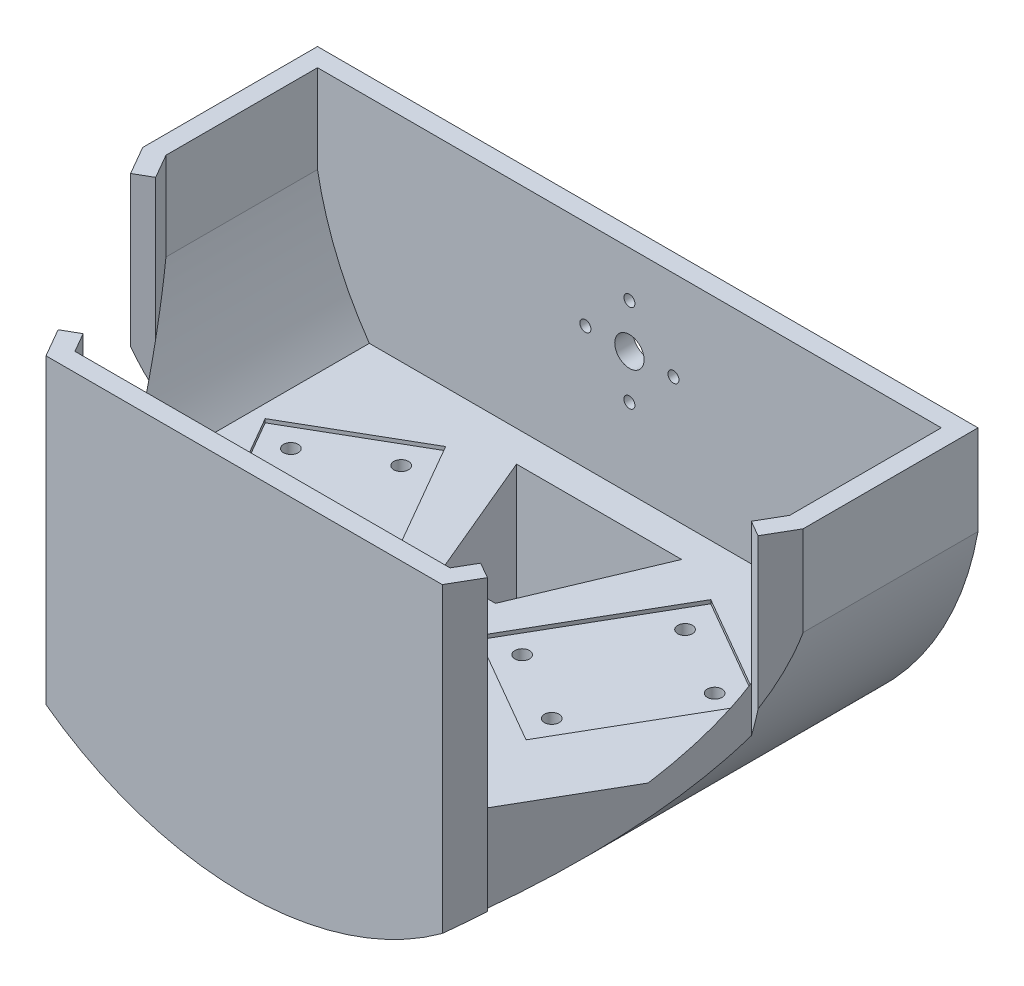
from build123d import *

# Parameters (mm, degrees)
BOSS_EXTRUDE1_DEPTH      = 50
BOSS_EXTRUDE1_DEPTH_BACK = 50
CUT_EXTRUDE1_DEPTH       = 151.665191733
SHELL1_T                 = -5
CUT_EXTRUDE2_START       = -5
CUT_EXTRUDE2_OUTLINE_W   = 54
CUT_EXTRUDE2_OUTLINE_H   = 87
CUT_EXTRUDE2_DEPTH       = 5
BOSS_EXTRUDE3_REACH      = 149.054
SKETCH6_R                = 2
CUT_EXTRUDE4_DEPTH       = 121.370262108
SKETCH6_4_R              = 2
CUT_EXTRUDE5_DEPTH       = 1
CUT_EXTRUDE6_DEPTH       = 31
SKETCH11_R               = 4
SKETCH11_R_2             = 1.5
CUT_EXTRUDE7_DEPTH       = 31
SKETCH12_R               = 4.5
CUT_EXTRUDE8_DEPTH       = 28
CUT_EXTRUDE10_REACH      = 122.37
CUT_EXTRUDE10_END_RADIUS = 86.3884
SKETCH14_W               = 15
SKETCH14_H               = 35.732848509
SKETCH14_W_2             = 30
SKETCH14_H_2             = 22.886792525


# Read off the part's stored shape, not the designer's step: Cut-Extrude2
with BuildPart() as part:
    # Sketch2 → Boss-Extrude1 (new, two sides: drawn at the far end of the back side and taken through both)
    with BuildSketch(Plane(origin=(0, 0, 0), x_dir=(1, 0, 0), z_dir=(0, 1, 0)).offset(-BOSS_EXTRUDE1_DEPTH_BACK)):
        Polygon((-90, 7.353829072), (-54, -55), (54, -55), (90, 7.353829072), (90, 55), (-90, 55), align=None)
    extrude(amount=BOSS_EXTRUDE1_DEPTH + BOSS_EXTRUDE1_DEPTH_BACK)

    # Sketch3 → Cut-Extrude1 (cut, through all)
    with BuildSketch(Plane(origin=(0, 0, -55), x_dir=(-1, 0, 0), z_dir=(0, 0, -1))):
        with BuildLine():
            ThreePointArc((4.5e-08, -50), (-58.743320462, -28.619184987), (-90, 25.518943344))
            Line((-90, 25.518943344), (-90, -50))
            Line((-90, -50), (4.5e-08, -50))
        make_face()
        with BuildLine():
            ThreePointArc((90, 25.518943344), (58.743320497, -28.619184957), (4.5e-08, -50))
            Line((4.5e-08, -50), (90, -50))
            Line((90, -50), (90, 25.518943344))
        make_face()
    extrude(amount=-CUT_EXTRUDE1_DEPTH, mode=Mode.SUBTRACT)

    # Shell1
    shell1_openings = [part.faces().sort_by_distance(p)[0] for p in [
        (0, 50, -4.375017638),
    ]]
    offset(amount=SHELL1_T, openings=shell1_openings, kind=Kind.INTERSECTION)

    # Cut-Extrude2 outline → Cut-Extrude2 (cut)
    with BuildSketch(Plane(origin=(-64.315698604, 0, 37.132685902), x_dir=(0.500000000000001, 0, 0.8660254037844382), z_dir=(-0.866025403784438, 0, 0.5000000000000009)).offset(CUT_EXTRUDE2_START)):
        with Locations((-15.368602792, 6.5)):
            Rectangle(CUT_EXTRUDE2_OUTLINE_W, CUT_EXTRUDE2_OUTLINE_H)
    cut_extrude2 = extrude(amount=CUT_EXTRUDE2_DEPTH, mode=Mode.SUBTRACT)

    # Mirror1: Cut-Extrude2 across plane
    add(cut_extrude2.mirror(Plane(origin=(0, 0, 0), x_dir=(0, 0, 1), z_dir=(1, 0, 0))), mode=Mode.SUBTRACT)

    # Boss-Extrude3: up to this face of the body (flat: up to its plane)
    boss_extrude3_end = Plane(part.part.faces().sort_by_distance((0, 5.038192354, 50))[0])
    # Sketch8 → Boss-Extrude3 (add, up to the picked face)
    with BuildSketch(Plane.XY.offset(-50), mode=Mode.PRIVATE) as boss_extrude3_sk1:
        with BuildLine():
            Line((76.893599213, -8), (-76.893599213, -8))
            ThreePointArc((-76.893599213, -8), (0, -50), (76.893599213, -8))
        make_face()
    boss_extrude3_tool1 = split(extrude(boss_extrude3_sk1.sketch, amount=BOSS_EXTRUDE3_REACH, mode=Mode.PRIVATE), bisect_by=boss_extrude3_end, keep=Keep.BOTH, mode=Mode.PRIVATE)
    add(boss_extrude3_tool1.solids().sort_by(Axis((0, -25.182235, -50), (0, 0, 1)))[0])

    # Sketch6 → Cut-Extrude4 (cut, through all)
    with BuildSketch(Plane(origin=(0, -8, 0), x_dir=(1, 0, 0), z_dir=(0, 1, 0))):
        with Locations(Location((-57.742314098, 15.481878155, 0), (0, 0, 270))):
            Circle(SKETCH6_R)
        with Locations(Location((-38.689755215, 26.481878155, 0), (0, 0, 270))):
            Circle(SKETCH6_R)
        with Locations(Location((-41.492314098, -12.663947468, 0), (0, 0, 270))):
            Circle(SKETCH6_R)
        with Locations(Location((-22.439755215, -1.663947468, 0), (0, 0, 270))):
            Circle(SKETCH6_R)
        with Locations(Location((22.439755215, -1.663947468, 0), (0, 0, 270))):
            Circle(SKETCH6_R)
        with Locations(Location((41.492314098, -12.663947468, 0), (0, 0, 270))):
            Circle(SKETCH6_R)
        with Locations(Location((38.689755215, 26.481878155, 0), (0, 0, 270))):
            Circle(SKETCH6_R)
        with Locations(Location((57.742314098, 15.481878155, 0), (0, 0, 270))):
            Circle(SKETCH6_R)
    extrude(amount=-CUT_EXTRUDE4_DEPTH, mode=Mode.SUBTRACT)

    # Sketch6<4> → Cut-Extrude5 (cut)
    # profile 1 of 2: a face of its own
    with BuildSketch(Plane(origin=(0, -8, 0), x_dir=(1, 0, 0), z_dir=(0, 1, 0))):
        Polygon((36.127577388, 36.044055982), (67.304491924, 18.044055982), (44.054491924, -22.226125294), (12.877577388, -4.226125294), align=None)
        with Locations(Location((38.689755215, 26.481878155, 0), (0, 0, 270))):
            Circle(SKETCH6_4_R, mode=Mode.SUBTRACT)
        with Locations(Location((22.439755215, -1.663947468, 0), (0, 0, 270))):
            Circle(SKETCH6_4_R, mode=Mode.SUBTRACT)
        with Locations(Location((41.492314098, -12.663947468, 0), (0, 0, 270))):
            Circle(SKETCH6_4_R, mode=Mode.SUBTRACT)
        with Locations(Location((57.742314098, 15.481878155, 0), (0, 0, 270))):
            Circle(SKETCH6_4_R, mode=Mode.SUBTRACT)
    # profile 2 of 2: a face of its own
    with BuildSketch(Plane(origin=(0, -8, 0), x_dir=(1, 0, 0), z_dir=(0, 1, 0))):
        Polygon((-36.127577388, 36.044055982), (-12.877577388, -4.226125294), (-44.054491924, -22.226125294), (-67.304491924, 18.044055982), align=None)
    extrude(amount=-CUT_EXTRUDE5_DEPTH, mode=Mode.SUBTRACT)

    # Sketch10 → Cut-Extrude6 (cut)
    with BuildSketch(Plane(origin=(0, -8, 0), x_dir=(1, 0, 0), z_dir=(0, 1, 0))):
        Polygon((-76.893599213, -5.347122994), (-54.169872981, -44.705771366), (-58.5, -47.205771366), (-56.886751346, -50), (-76.893599213, -50), align=None)
    cut_extrude6 = extrude(amount=-CUT_EXTRUDE6_DEPTH, mode=Mode.SUBTRACT)

    # Mirror2: Cut-Extrude6 across plane
    add(cut_extrude6.mirror(Plane(origin=(0, 0, 0), x_dir=(0, 0, 1), z_dir=(1, 0, 0))), mode=Mode.SUBTRACT)

    # Sketch11 → Cut-Extrude7 (cut)
    with BuildSketch(Plane(origin=(0, 0, -55), x_dir=(-1, 0, 0), z_dir=(0, 0, -1))):
        with Locations((0, 25.54)):
            Circle(SKETCH11_R)
        with Locations((-12, 25.54)):
            Circle(SKETCH11_R_2)
        with Locations((0, 37.54)):
            Circle(SKETCH11_R_2)
        with Locations((12, 25.54)):
            Circle(SKETCH11_R_2)
        with Locations((0, 13.54)):
            Circle(SKETCH11_R_2)
    extrude(amount=-CUT_EXTRUDE7_DEPTH, mode=Mode.SUBTRACT)

    # Sketch12 → Cut-Extrude8 (cut)
    with BuildSketch(Plane(origin=(0, -50, 0), x_dir=(1, 0, 0), z_dir=(0, 1, 0))):
        with Locations(Location((-41.492314098, -12.663947468, 0), (0, 0, 90))):
            Circle(SKETCH12_R)
        with Locations(Location((-57.742314098, 15.481878155, 0), (0, 0, 90))):
            Circle(SKETCH12_R)
        with Locations(Location((-38.689755215, 26.481878155, 0), (0, 0, 90))):
            Circle(SKETCH12_R)
        with Locations(Location((57.742314098, 15.481878155, 0), (0, 0, 90))):
            Circle(SKETCH12_R)
        with Locations(Location((-22.439755215, -1.663947468, 0), (0, 0, 90))):
            Circle(SKETCH12_R)
        with Locations(Location((38.689755215, 26.481878155, 0), (0, 0, 90))):
            Circle(SKETCH12_R)
        with Locations(Location((41.492314098, -12.663947468, 0), (0, 0, 90))):
            Circle(SKETCH12_R)
        with Locations(Location((22.439755215, -1.663947468, 0), (0, 0, 90))):
            Circle(SKETCH12_R)
    extrude(amount=CUT_EXTRUDE8_DEPTH, mode=Mode.SUBTRACT)

    # Cut-Extrude10: up to this cylinder (the profile starts inside it)
    cut_extrude10_end = Plane(origin=(0, 41.3884, 1.910921), z_dir=(0, 0, -1)) * Cylinder(CUT_EXTRUDE10_END_RADIUS, 481.618704, mode=Mode.PRIVATE)
    # Sketch14 → Cut-Extrude10 (cut, up to the surface)
    with BuildSketch(Plane(origin=(0, -8, 0), x_dir=(1, 0, 0), z_dir=(0, 1, 0)), mode=Mode.PRIVATE) as cut_extrude10_sk1:
        Polygon((-22.317136957, 41.550980906), (-7.317136957, 41.550980906), (-7.317136957, 5.818132397), align=None)
    cut_extrude10_tool1 = extrude(cut_extrude10_sk1.sketch, amount=-CUT_EXTRUDE10_REACH, mode=Mode.PRIVATE) & cut_extrude10_end
    add(cut_extrude10_tool1.solids().sort_by_distance((-12.317137, -8, -29.640031))[0], mode=Mode.SUBTRACT)
    # Sketch14 → Cut-Extrude10 (cut, up to the surface)
    with BuildSketch(Plane(origin=(0, -8, 0), x_dir=(1, 0, 0), z_dir=(0, 1, 0)), mode=Mode.PRIVATE) as cut_extrude10_sk2:
        Polygon((7.682863043, 5.818132397), (22.682863043, 41.550980906), (7.682863043, 41.550980906), align=None)
    cut_extrude10_tool2 = extrude(cut_extrude10_sk2.sketch, amount=-CUT_EXTRUDE10_REACH, mode=Mode.PRIVATE) & cut_extrude10_end
    add(cut_extrude10_tool2.solids().sort_by_distance((12.682863, -8, -29.640031))[0], mode=Mode.SUBTRACT)
    # Sketch14 → Cut-Extrude10 (cut, up to the surface)
    with BuildSketch(Plane(origin=(0, -8, 0), x_dir=(1, 0, 0), z_dir=(0, 1, 0)), mode=Mode.PRIVATE) as cut_extrude10_sk3:
        with Locations((0.182863043, 23.684556651)):
            Rectangle(SKETCH14_W, SKETCH14_H)
    cut_extrude10_tool3 = extrude(cut_extrude10_sk3.sketch, amount=-CUT_EXTRUDE10_REACH, mode=Mode.PRIVATE) & cut_extrude10_end
    add(cut_extrude10_tool3.solids().sort_by_distance((0.182863, -8, -23.684557))[0], mode=Mode.SUBTRACT)
    # Sketch14 → Cut-Extrude10 (cut, up to the surface)
    with BuildSketch(Plane(origin=(0, -8, 0), x_dir=(1, 0, 0), z_dir=(0, 1, 0)), mode=Mode.PRIVATE) as cut_extrude10_sk4:
        with Locations((0.6696167, -29.647407325)):
            Rectangle(SKETCH14_W_2, SKETCH14_H_2)
    cut_extrude10_tool4 = extrude(cut_extrude10_sk4.sketch, amount=-CUT_EXTRUDE10_REACH, mode=Mode.PRIVATE) & cut_extrude10_end
    add(cut_extrude10_tool4.solids().sort_by_distance((0.669617, -8, 29.647407))[0], mode=Mode.SUBTRACT)
    # Sketch14 → Cut-Extrude10 (cut, up to the surface)
    with BuildSketch(Plane(origin=(0, -8, 0), x_dir=(1, 0, 0), z_dir=(0, 1, 0)), mode=Mode.PRIVATE) as cut_extrude10_sk5:
        Polygon((-14.3303833, -18.204011062), (-44.3303833, -41.090803587), (-14.3303833, -41.090803587), align=None)
    cut_extrude10_tool5 = extrude(cut_extrude10_sk5.sketch, amount=-CUT_EXTRUDE10_REACH, mode=Mode.PRIVATE) & cut_extrude10_end
    add(cut_extrude10_tool5.solids().sort_by_distance((-24.330383, -8, 33.461873))[0], mode=Mode.SUBTRACT)
    # Sketch14 → Cut-Extrude10 (cut, up to the surface)
    with BuildSketch(Plane(origin=(0, -8, 0), x_dir=(1, 0, 0), z_dir=(0, 1, 0)), mode=Mode.PRIVATE) as cut_extrude10_sk6:
        Polygon((45.6696167, -41.090803587), (15.6696167, -41.090803587), (15.6696167, -18.204011062), align=None)
    cut_extrude10_tool6 = extrude(cut_extrude10_sk6.sketch, amount=-CUT_EXTRUDE10_REACH, mode=Mode.PRIVATE) & cut_extrude10_end
    add(cut_extrude10_tool6.solids().sort_by_distance((25.669617, -8, 33.461873))[0], mode=Mode.SUBTRACT)


solid = part.part
